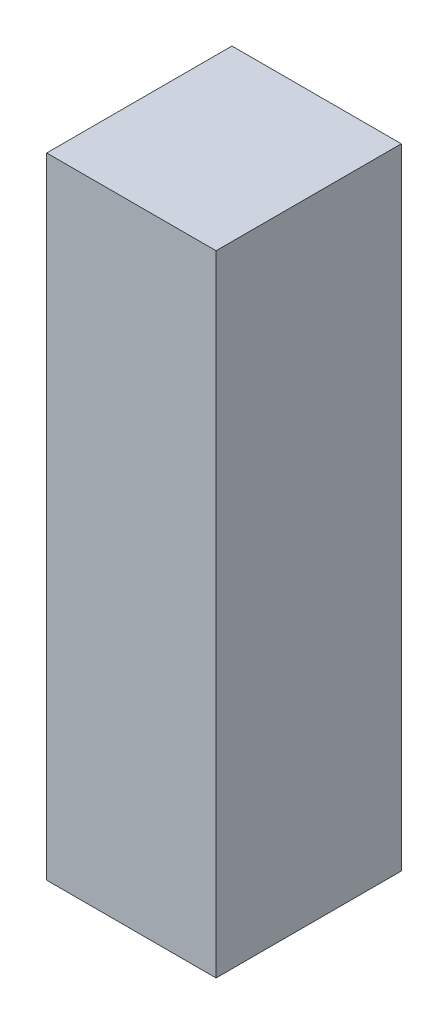
from build123d import *

# Parameters (mm, degrees)
SKETCH1_W           = 32
SKETCH1_H           = 35
BOSS_EXTRUDE1_DEPTH = 119


with BuildPart() as part:
    # Sketch1 → Boss-Extrude1 (new body)
    with BuildSketch(Plane(origin=(0, 0, 0), x_dir=(1, 0, 0), z_dir=(0, 1, 0))):
        with Locations((16, 17.5)):
            Rectangle(SKETCH1_W, SKETCH1_H)
    extrude(amount=BOSS_EXTRUDE1_DEPTH)


solid = part.part
